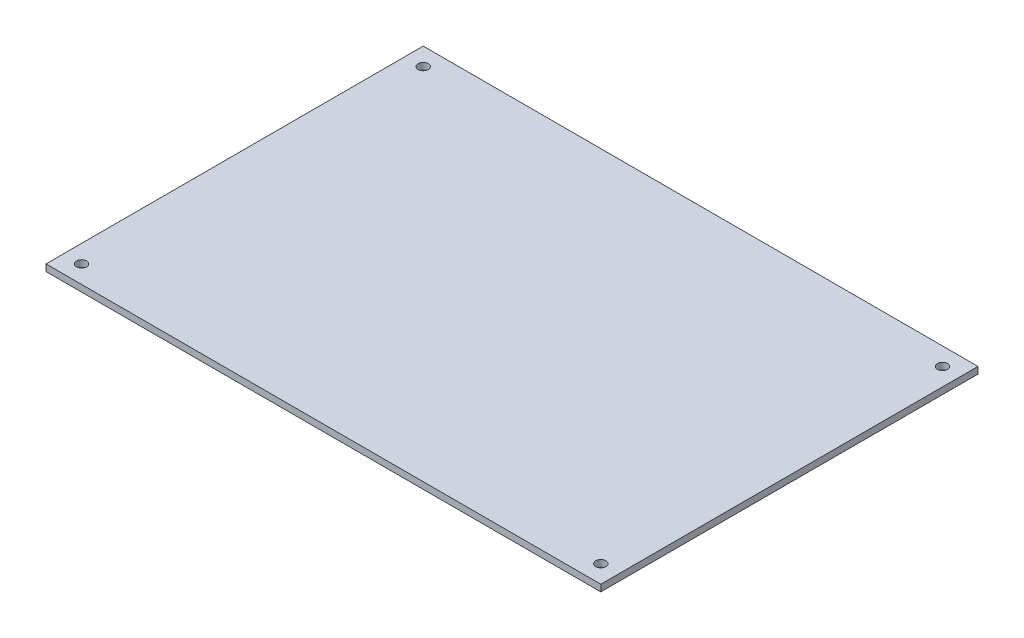
from build123d import *

# Parameters (mm, degrees)
BOSS_EXTRU_1_DEPTH      = 1.5
BOSS_EXTRU_1_DEPTH_BACK = 0.0018
ESQUISSE1_W             = 124.992092973
ESQUISSE1_H             = 84.985144333
BOSS_EXTRU_5_START      = -1.5018
BOSS_EXTRU_5_OUTLINE_R  = 1.15
BOSS_EXTRU_5_DEPTH      = 1.5018
ESQUISSE5_R             = 1.15
ENL_V_MAT_EXTRU_1_DEPTH = 13
ESQUISSE6_R             = 1.15
ENL_V_MAT_EXTRU_2_DEPTH = 1.577439541
ESQUISSE7_R             = 1.15
ENL_V_MAT_EXTRU_3_DEPTH = 1.51


# Read off the part's stored shape, not the designer's step: Boss.-Extru.5
with BuildPart() as part:
    # Esquisse1 → Boss.-Extru.1 (new, two sides: drawn at the far end of the back side and taken through both)
    with BuildSketch(Plane(origin=(0, 0, 0), x_dir=(1, 0, 0), z_dir=(0, 1, 0)).offset(-BOSS_EXTRU_1_DEPTH_BACK)):
        with Locations((-104.249914402, -23.089910991)):
            Rectangle(ESQUISSE1_W, ESQUISSE1_H)
    extrude(amount=BOSS_EXTRU_1_DEPTH + BOSS_EXTRU_1_DEPTH_BACK)

    # Boss.-Extru.5 outline → Boss.-Extru.5 (cut)
    with BuildSketch(Plane(origin=(0, 1.5, 0), x_dir=(1, 0, 0), z_dir=(0, 1, 0)).offset(BOSS_EXTRU_5_START)):
        with Locations((-162.745960889, -61.582483158)):
            Circle(BOSS_EXTRU_5_OUTLINE_R)
    extrude(amount=BOSS_EXTRU_5_DEPTH, mode=Mode.SUBTRACT)

    # Esquisse5 → Enlèv. mat.-Extru.1 (cut)
    with BuildSketch(Plane(origin=(0, 1.5, 0), x_dir=(1, 0, 0), z_dir=(0, 1, 0))):
        with Locations(Location((-162.745960889, 15.402661175, 0), (0, 0, 270))):
            Circle(ESQUISSE5_R)
    extrude(amount=-ENL_V_MAT_EXTRU_1_DEPTH, mode=Mode.SUBTRACT)

    # Esquisse6 → Enlèv. mat.-Extru.2 (cut)
    with BuildSketch(Plane(origin=(0, 1.5, 0), x_dir=(1, 0, 0), z_dir=(0, 1, 0))):
        with Locations(Location((-45.753867916, 15.402661175, 0), (0, 0, 270))):
            Circle(ESQUISSE6_R)
    extrude(amount=-ENL_V_MAT_EXTRU_2_DEPTH, mode=Mode.SUBTRACT)

    # Esquisse7 → Enlèv. mat.-Extru.3 (cut)
    with BuildSketch(Plane(origin=(0, 1.5, 0), x_dir=(1, 0, 0), z_dir=(0, 1, 0))):
        with Locations(Location((-45.753867916, -61.582483158, 0), (0, 0, 270))):
            Circle(ESQUISSE7_R)
    extrude(amount=-ENL_V_MAT_EXTRU_3_DEPTH, mode=Mode.SUBTRACT)


solid = part.part
